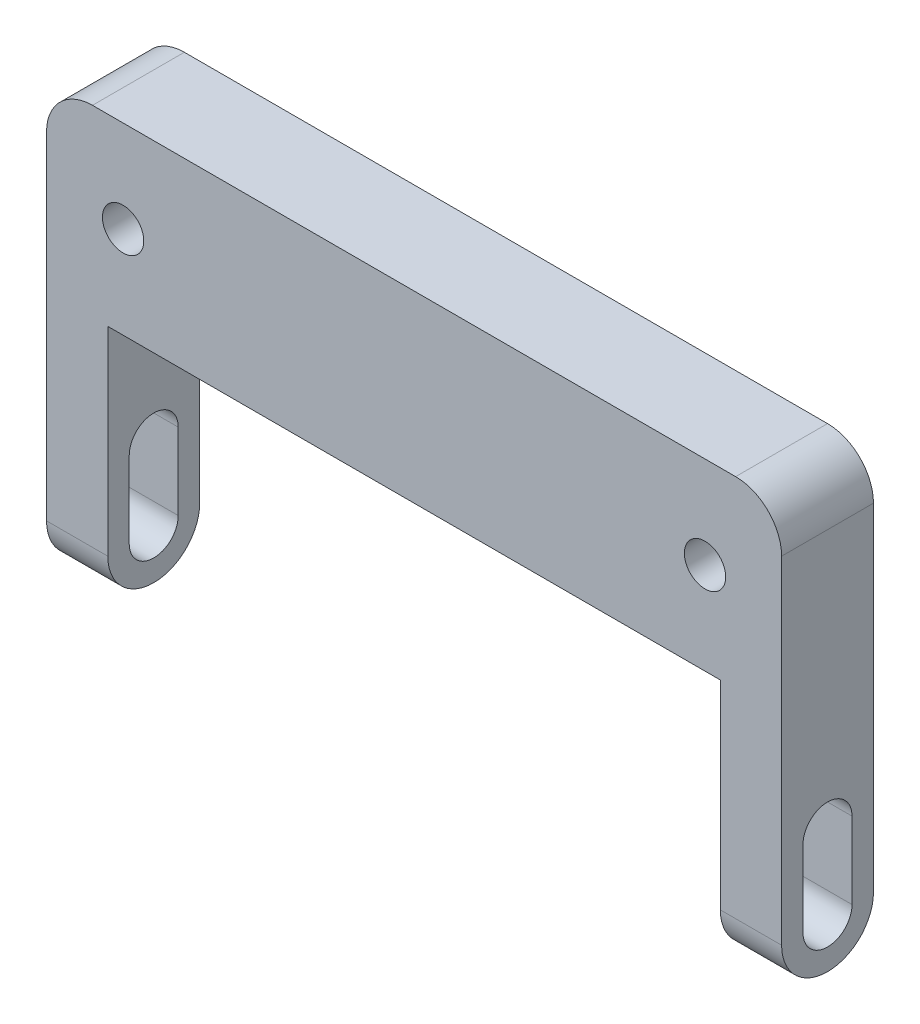
from build123d import *

# Parameters (mm, degrees)
EXTRUDE_1_DEPTH     = 6
CUT_EXTRUDE_1_REACH = 55.141
FILLET_1_R          = 3
SKETCH_3_R          = 1.35
CUT_EXTRUDE_2_DEPTH = 34.105890714


with BuildPart() as part:
    # 草圖1 → 填料-伸長1 (new body)
    with BuildSketch(Plane.XY):
        Polygon((-20, -6), (20, -6), (20, -22), (24, -22), (24, -6), (24, 6), (-24, 6), (-24, -6), (-24, -22), (-20, -22), align=None)
    extrude(amount=EXTRUDE_1_DEPTH)

    # 草圖2 → 除料-伸長1 (cut, up to next)
    with BuildSketch(Plane(origin=(24, 0, 0), x_dir=(0, 0, -1), z_dir=(1, 0, 0)), mode=Mode.PRIVATE) as cut_extrude_1_sk1:
        with BuildLine():
            Line((-1.4, -14), (-1.4, -19))
            ThreePointArc((-1.4, -19), (-3, -20.6), (-4.6, -19))
            Line((-4.6, -19), (-4.6, -14))
            ThreePointArc((-4.6, -14), (-3, -12.4), (-1.4, -14))
        make_face()
    cut_extrude_1_tool1 = extrude(cut_extrude_1_sk1.sketch, amount=-CUT_EXTRUDE_1_REACH, mode=Mode.PRIVATE) & part.part
    cut_extrude_1 = cut_extrude_1_tool1.solids().sort_by_distance((24, -16.5, 3))[0]
    add(cut_extrude_1, mode=Mode.SUBTRACT)

    # 鏡射1: 除料-伸長1 across plane
    add(cut_extrude_1.mirror(Plane(origin=(0, 0, 0), x_dir=(0, 0, 1), z_dir=(1, 0, 0))), mode=Mode.SUBTRACT)

    # 圓角1
    fillet_1_edges = [part.edges().sort_by_distance(p)[0] for p in [
        (-24, 6, 3),
        (24, 6, 3),
        (-22, -22, 6),
        (-22, -22, 0),
        (22, -22, 0),
        (22, -22, 6),
    ]]
    fillet(fillet_1_edges, radius=FILLET_1_R - 0.0001)  # a hair under: the kernel refuses the full size

    # 草圖3 → 除料-伸長2 (cut, through all)
    with BuildSketch(Plane(origin=(0, 0, 0), x_dir=(-1, 0, 0), z_dir=(0, 0, -1))):
        with Locations((19, 0)):
            Circle(SKETCH_3_R)
        with Locations((-19, 0)):
            Circle(SKETCH_3_R)
    extrude(amount=-CUT_EXTRUDE_2_DEPTH, mode=Mode.SUBTRACT)


solid = part.part
